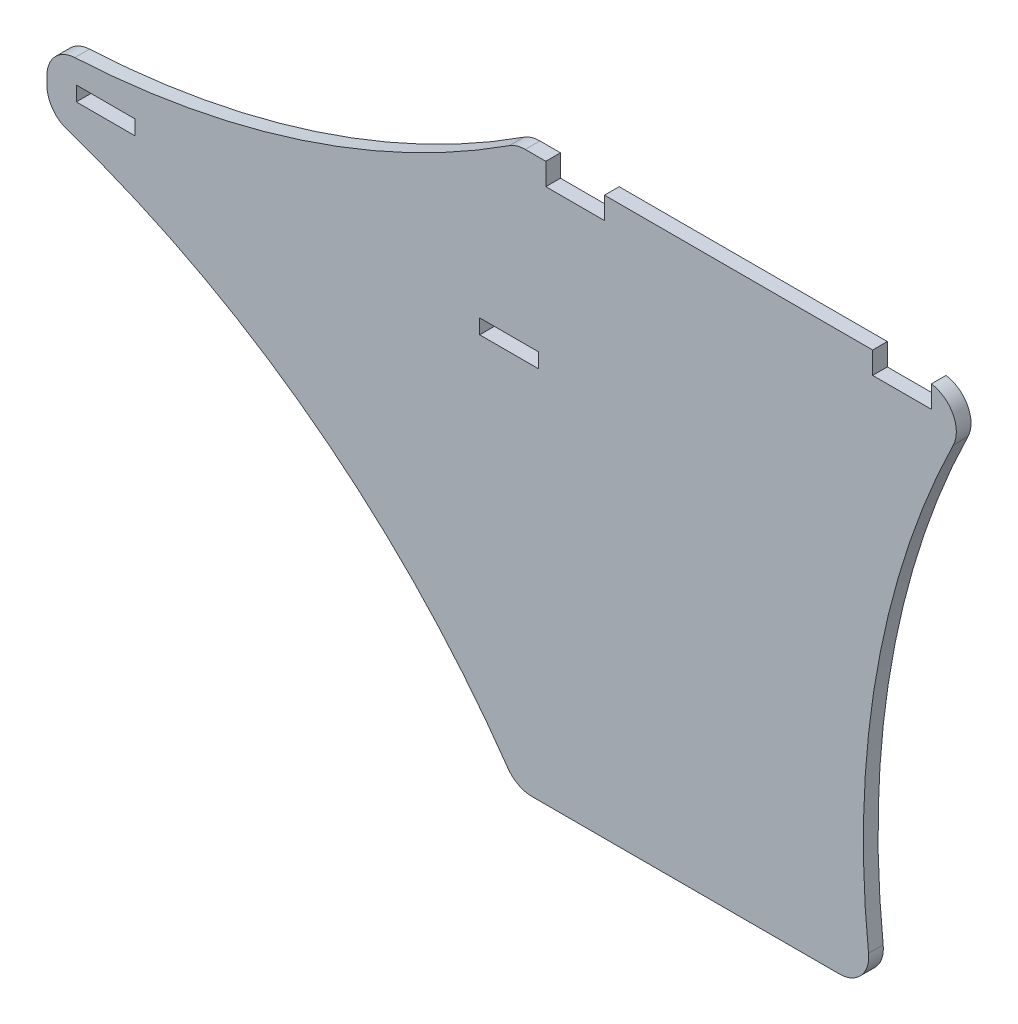
from build123d import *

# Parameters (mm, degrees)
EXTRUDE1_DEPTH     = 6.35
CUT_EXTRUDE1_REACH = 327.914
SKETCH2_W          = 25.4
SKETCH2_H          = 6.35
FILLET1_R          = 12.7


with BuildPart() as part:
    # Sketch1 → Extrude1 (new body)
    with BuildSketch(Plane.XY):
        with BuildLine():
            Line((-119.0625, -9.525), (-119.0625, 15.875))
            ThreePointArc((-119.0625, 15.875), (-12.912203714, 33.137302813), (84.185416539, 79.375))
            Line((84.185416539, 79.375), (96.885416539, 79.375))
            Line((96.885416539, 79.375), (96.885416539, 69.85))
            Line((96.885416539, 69.85), (122.285416539, 69.85))
            Line((122.285416539, 69.85), (122.285416539, 79.375))
            Line((122.285416539, 79.375), (238.394583461, 79.375))
            Line((238.394583461, 79.375), (238.394583461, 69.85))
            Line((238.394583461, 69.85), (263.794583461, 69.85))
            Line((263.794583461, 69.85), (263.794583461, 79.375))
            Line((263.794583461, 79.375), (282.844583461, 79.375))
            ThreePointArc((282.844583461, 79.375), (240.685076339, -37.537420224), (238.394583461, -161.797999999))
            Line((238.394583461, -161.797999999), (84.185416539, -161.797999999))
            ThreePointArc((84.185416539, -161.797999999), (-4.377647242, -68.228339866), (-119.0625, -9.525))
        make_face()
    extrude(amount=EXTRUDE1_DEPTH)

    # Sketch2 → Cut-Extrude1 (cut, up to next)
    with BuildSketch(Plane.XY.offset(6.35), mode=Mode.PRIVATE) as cut_extrude1_sk1:
        with Locations((80.9625, 3.175)):
            Rectangle(SKETCH2_W, SKETCH2_H)
    cut_extrude1_tool1 = extrude(cut_extrude1_sk1.sketch, amount=-CUT_EXTRUDE1_REACH, mode=Mode.PRIVATE) & part.part
    # Sketch2 → Cut-Extrude1 (cut, up to next)
    with BuildSketch(Plane.XY.offset(6.35), mode=Mode.PRIVATE) as cut_extrude1_sk2:
        with Locations((-93.6625, 3.175)):
            Rectangle(SKETCH2_W, SKETCH2_H)
    cut_extrude1_tool2 = extrude(cut_extrude1_sk2.sketch, amount=-CUT_EXTRUDE1_REACH, mode=Mode.PRIVATE) & part.part
    add(cut_extrude1_tool1.solids().sort_by_distance((80.9625, 3.175, 6.35))[0], mode=Mode.SUBTRACT)
    add(cut_extrude1_tool2.solids().sort_by_distance((-93.6625, 3.175, 6.35))[0], mode=Mode.SUBTRACT)

    # Fillet1
    # the kernel refuses this fillet: 12.7 mm, written as the material it takes off along each edge
    with BuildSketch(Plane(origin=(-119.0625, -9.525, -23.042479417), x_dir=(0, 1, 0), z_dir=(0, 0, 1))) as fillet1_piece_1:
        with BuildLine():
            CenterArc((9.216991767, -12.7), FILLET1_R, 90, 71.264145378)
            Line((-2.810028359, -8.620687938), (-3.050568761, -8.539101697))
            ThreePointArc((-3.050568761, -8.539101697), (-1.620862846, -4.239985213), (-0.242413755, 0.075839116))
            Line((-0.242413755, 0.075839116), (0, 0.254))
            Line((0, 0.254), (9.216991767, 0.254))
            Line((9.216991767, 0.254), (9.216991767, 0))
        make_face()
    extrude(amount=52.434958835, mode=Mode.SUBTRACT)
    with BuildSketch(Plane(origin=(-119.0625, 15.875, -30.640711511), x_dir=(0, -1, 0), z_dir=(0, 0, 1))) as fillet1_piece_2:
        with BuildLine():
            CenterArc((12.256284605, 12.7), FILLET1_R, 182.936375733, 87.063624267)
            Line((-0.427040748, 12.049417188), (-0.680707255, 12.036405531))
            ThreePointArc((-0.680707255, 12.036405531), (-0.419694109, 6.017401636), (-0.253951201, -0.004978711))
            Line((-0.253951201, -0.004978711), (0, -0.254))
            Line((0, -0.254), (12.256284605, -0.254))
            Line((12.256284605, -0.254), (12.256284605, 0))
        make_face()
    extrude(amount=67.631423023, mode=Mode.SUBTRACT)
    with BuildSketch(Plane(origin=(84.185416539, 79.375, -9.493460645), x_dir=(-0.8358425258463126, -0.5489692814601342, 0), z_dir=(0, 0, 1))) as fillet1_piece_3:
        with BuildLine():
            CenterArc((3.797894625, 12.699847386), FILLET1_R, 236.703669928, 33.015441722)
            Line((-3.17401525, 2.084647308), (-3.313453447, 1.872343306))
            Line((-3.313453447, 1.872343306), (-0.139438197, -0.212304002))
            Line((-0.139438197, -0.212304002), (0.001245211, -0.253996948))
            ThreePointArc((0.001245211, -0.253996948), (1.867817029, -0.249421573), (3.734388846, -0.253996948))
            Line((3.734388846, -0.253996948), (3.735634057, 0))
        make_face()
    extrude(amount=25.33692129, mode=Mode.SUBTRACT)
    with BuildSketch(Plane(origin=(282.844583461, 79.375, -51.250606191), x_dir=(-0.4644541508381782, -0.8855971667576557, 0), z_dir=(0, 0, 1))) as fillet1_piece_4:
        with BuildLine():
            CenterArc((20.841913184, -12.695403149), FILLET1_R, 91.541626127, 107.65176457)
            Line((8.847851573, -16.870626027), (8.607970341, -16.954130484))
            ThreePointArc((8.607970341, -16.954130484), (4.198984106, -8.553284368), (-0.22494168, -0.117971354))
            Line((-0.22494168, -0.117971354), (0.006833414, 0.253908063))
            ThreePointArc((0.006833414, 0.253908063), (10.250121238, 0.116094484), (20.493409062, 0.253908063))
            Line((20.493409062, 0.253908063), (20.500242476, 0))
        make_face()
    extrude(amount=108.851212382, mode=Mode.SUBTRACT)
    with BuildSketch(Plane(origin=(238.394583461, -161.797999999, -36.048448379), x_dir=(-1, 0, 0), z_dir=(0, 0, 1))) as fillet1_piece_5:
        with BuildLine():
            CenterArc((14.419379352, -12.7), FILLET1_R, 90, 96.197539908)
            Line((1.793603229, -14.071049709), (1.541087707, -14.098470704))
            ThreePointArc((1.541087707, -14.098470704), (0.710330378, -7.0592939), (-0.251319787, -0.036801694))
            Line((-0.251319787, -0.036801694), (0, 0.254))
            Line((0, 0.254), (14.419379352, 0.254))
            Line((14.419379352, 0.254), (14.419379352, 0))
        make_face()
    extrude(amount=78.446896758, mode=Mode.SUBTRACT)
    with BuildSketch(Plane(origin=(84.185416539, -161.797999999, -16.813294938), x_dir=(-0.561921339312421, 0.827190672351505, 0), z_dir=(0, 0, 1))) as fillet1_piece_6:
        with BuildLine():
            CenterArc((6.726221855, -12.699521307), FILLET1_R, 90.497468654, 55.313755774)
            Line((-3.779099684, -5.563120298), (-3.989206115, -5.420392277))
            Line((-3.989206115, -5.420392277), (-0.210106431, 0.14272802))
            Line((-0.210106431, 0.14272802), (0.002205319, 0.253990426))
            ThreePointArc((0.002205319, 0.253990426), (3.307977961, 0.239639207), (6.613750604, 0.253990426))
            Line((6.613750604, 0.253990426), (6.615955923, 0))
        make_face()
    extrude(amount=39.976589876, mode=Mode.SUBTRACT)


solid = part.part
